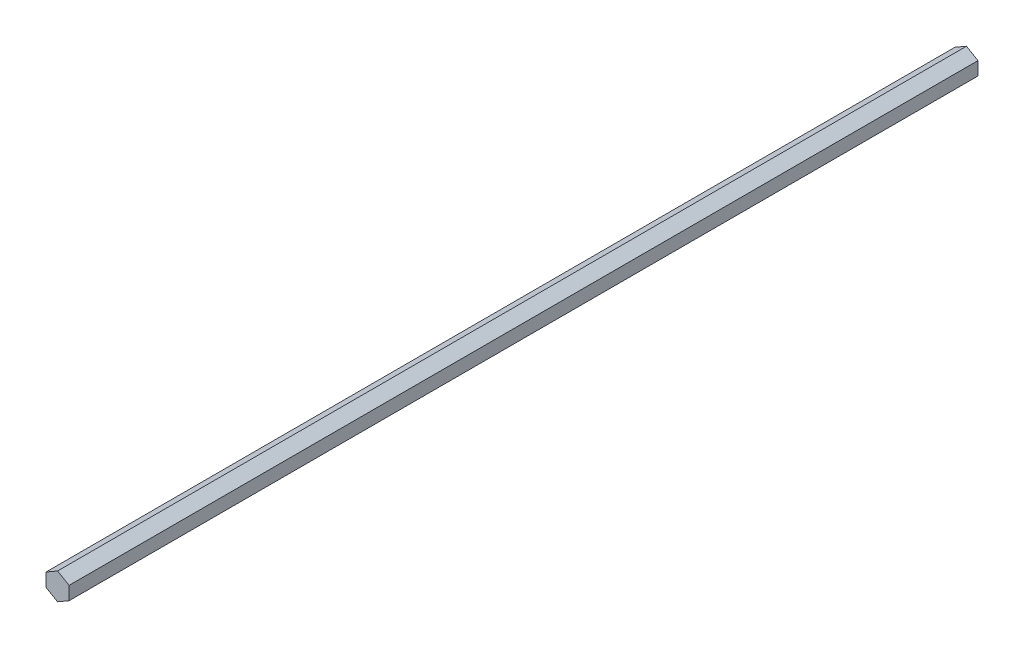
from build123d import *

# Parameters (mm, degrees)
BOSS_EXTRUDE1_DEPTH = 500


with BuildPart() as part:
    # Sketch1 → Boss-Extrude1 (new body)
    with BuildSketch(Plane.XY):
        Polygon((0, 7.332348419), (-6.35, 3.666174209), (-6.35, -3.666174209), (0, -7.332348419), (6.35, -3.666174209), (6.35, 3.666174209), align=None)
    extrude(amount=BOSS_EXTRUDE1_DEPTH)


solid = part.part
